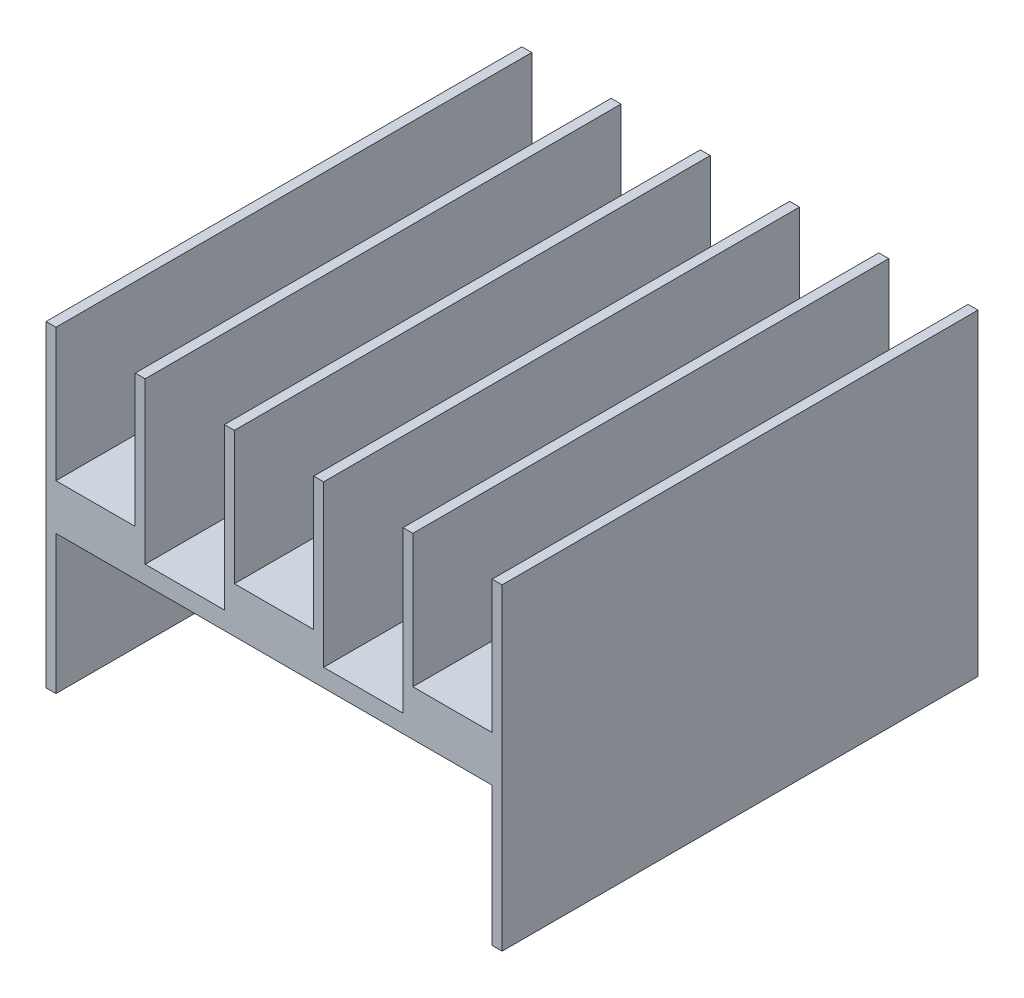
from build123d import *

# Parameters (mm, degrees)
BOSS_EXTRUDE1_DEPTH     = 24
CUT_EXTRUDE3_DEPTH      = 9
CUT_EXTRUDE3_DEPTH_BACK = 9
SKETCH3_R               = 1.5
THREAD1_PITCH           = 0.25


with BuildPart() as part:
    # Sketch1 → Boss-Extrude1 (new body)
    with BuildSketch(Plane.XY):
        Polygon((11, -1), (11, -8), (11.5, -8), (11.5, 8), (11, 8), (11, 1.3), (7, 1.3), (7, 8), (6.5, 8), (6.5, -0.1), (2.5, -0.1), (2.5, 8), (2, 8), (2, 1.3), (-2, 1.3), (-2, 8), (-2.5, 8), (-2.5, -0.1), (-6.5, -0.1), (-6.5, 8), (-7, 8), (-7, 1.3), (-11, 1.3), (-11, 8), (-11.5, 8), (-11.5, -8), (-11, -8), (-11, -1), align=None)
    extrude(amount=BOSS_EXTRUDE1_DEPTH)

    # Sketch3 → Cut-Extrude3 (cut, two sides: drawn at the far end of the back side and taken through both)
    with BuildSketch(Plane(origin=(0, 0, 0), x_dir=(1, 0, 0), z_dir=(0, 1, 0)).offset(-CUT_EXTRUDE3_DEPTH_BACK)):
        with Locations(Location((0, -6, 0), (0, 0, 270))):
            Circle(SKETCH3_R)
    extrude(amount=CUT_EXTRUDE3_DEPTH + CUT_EXTRUDE3_DEPTH_BACK, mode=Mode.SUBTRACT)

    # Thread1: the profile of Thread Profile1 profile screwed along a right-hand helix of 9.2 turns, 6 arcs to a turn; built about Z, then put on its axis
    thread1_z = Axis((0, 0, 0), (0, 0, 1))
    thread1_corners = [(1.4997, 0, -0.000173205), (1.635316469, 0, 0.078125), (1.635316469, 0, 0.109375), (1.4997, 0, 0.187673204)]
    with BuildLine(mode=Mode.PRIVATE) as thread1_profile:
        Line(thread1_corners[0], thread1_corners[1])
        Line(thread1_corners[1], thread1_corners[2])
        Line(thread1_corners[2], thread1_corners[3])
        Line(thread1_corners[3], thread1_corners[0])
    thread1_cap = Face(thread1_profile.wire())
    thread1_turn_angles = [0, 30, 60, 90, 120, 150, 180, 210, 240, 270, 300, 330, 360]
    thread1_turn_weights = [1, 0.8660254037844387, 1, 0.8660254037844387, 1, 0.8660254037844387, 1, 0.8660254037844387, 1, 0.8660254037844387, 1, 0.8660254037844387, 1]
    thread1_turn_rails = [Edge.make_bspline([Vector(p[0], p[1], 0).rotate(thread1_z, thread1_turn_angles[k]) / thread1_turn_weights[k] + Vector(0, 0, p[2] + THREAD1_PITCH * thread1_turn_angles[k] / 360) for k in range(13)], [0, 0, 0, 1, 1, 2, 2, 3, 3, 4, 4, 5, 5, 6, 6, 6], 2, thread1_turn_weights) for p in thread1_corners]
    thread1_turn_sides = [Face.make_surface_from_curves(thread1_turn_rails[p[0]], thread1_turn_rails[p[1]]) for p in [(0, 1), (1, 2), (2, 3), (3, 0)]]
    thread1_last_angles = [3240, 3270, 3300, 3306, 3312]
    thread1_last_weights = [1, 0.8660254037844387, 1, 0.9945218953682737, 1]
    thread1_last_rails = [Edge.make_bspline([Vector(p[0], p[1], 0).rotate(thread1_z, thread1_last_angles[k]) / thread1_last_weights[k] + Vector(0, 0, p[2] + THREAD1_PITCH * thread1_last_angles[k] / 360) for k in range(5)], [0, 0, 0, 1, 1, 2, 2, 2], 2, thread1_last_weights) for p in thread1_corners]
    thread1_last_sides = [Face.make_surface_from_curves(thread1_last_rails[p[0]], thread1_last_rails[p[1]]) for p in [(0, 1), (1, 2), (2, 3), (3, 0)]]
    thread1 = Plane(origin=(0, -1, 6), x_dir=(1, 0, 0), z_dir=(0, 1, 0)) * Solid(Shell([*[p.moved(Location((0, 0, THREAD1_PITCH * i))) for i in range(9) for p in thread1_turn_sides], *thread1_last_sides, thread1_cap, thread1_cap.rotate(thread1_z, 3312).moved(Location((0, 0, THREAD1_PITCH * 3312 / 360)))]))
    add(thread1, mode=Mode.SUBTRACT)


solid = part.part
